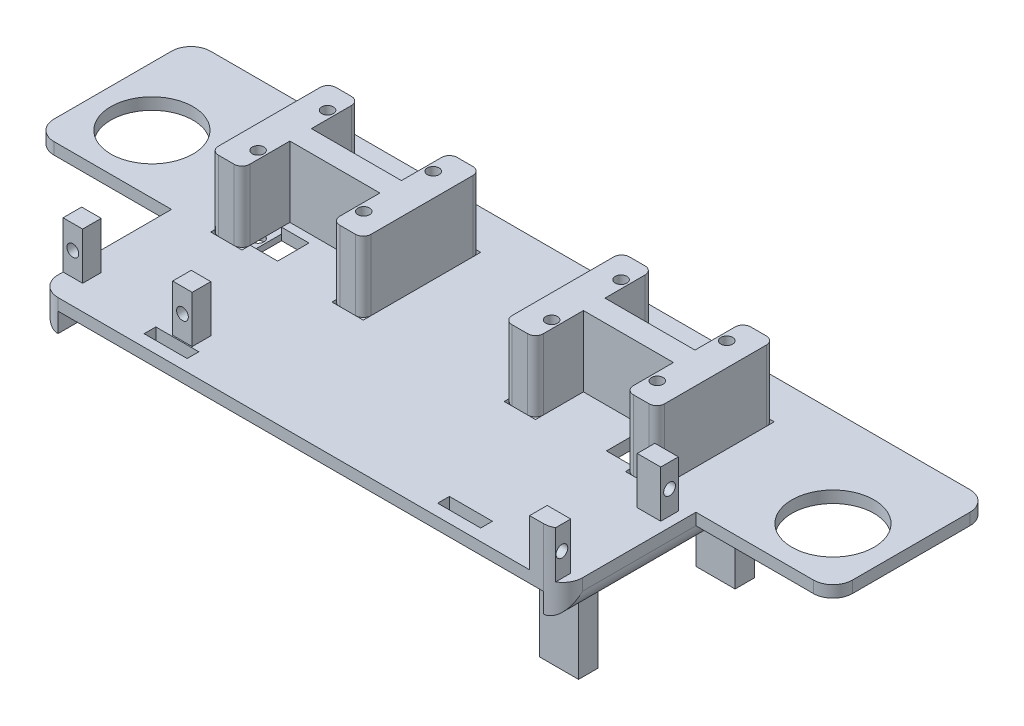
from build123d import *

# Parameters (mm, degrees)
C_BRACKET_DEPTH             = 10
SKETCH3_W                   = 35
SKETCH3_H                   = 40
SKETCH3_R                   = 10.5
MAIN_BODY_DEPTH             = 3
SKETCH4_W                   = 5
SKETCH4_H                   = 74
BOSS_EXTRUDE4_DEPTH         = 5
SKETCH6_W                   = 10
SKETCH6_H                   = 45
C_BRACKET_INSERT_DEPTH      = 1.5
MOTOR_HOLDERS_DEPTH         = 18
MOTOR_HOLDERS_2_DEPTH       = 18
MOTOR_HOLDER_INSERT_DEPTH   = 1.5
STRAP_START                 = -21
SKETCH12_R                  = 1.5
SKETCH12_W                  = 7
SKETCH12_H                  = 8
SKETCH12_W_2                = 11
SKETCH12_H_2                = 3
SKETCH12_W_3                = 5
STRAP_AND_SCREW_HOLES_DEPTH = 21
SKETCH13_W                  = 6
SKETCH13_H                  = 4.5
BOSS_EXTRUDE8_DEPTH         = 12
SKETCH14_R                  = 1.5
CUT_EXTRUDE6_DEPTH          = 6
SKETCH15_W                  = 5
SKETCH15_H                  = 4.75
BOSS_EXTRUDE9_DEPTH         = 12
SKETCH16_R                  = 1.5
CUT_EXTRUDE7_DEPTH          = 4.75
FILLET1_R                   = 5
FILLET2_R                   = 2
FILLET3_R                   = 2
SKETCH17_W                  = 40
SKETCH17_H                  = 10
BOSS_EXTRUDE11_DEPTH        = 5


with BuildPart() as part:
    # Sketch1 → C Bracket (new body)
    with BuildSketch(Plane(origin=(0, 0, 0), x_dir=(0, 0, -1), z_dir=(1, 0, 0))):
        Polygon((0, 0), (0, 30), (45, 30), (45, 0), (40, 0), (40, 27), (5, 27), (5, 0), align=None)
    extrude(amount=C_BRACKET_DEPTH)


with BuildPart() as body_2:
    # Sketch3 → Main Body (new body)
    # profile 1 of 3: a face of its own
    with BuildSketch(Plane(origin=(0, 30, 0), x_dir=(1, 0, 0), z_dir=(0, 1, 0))):
        Polygon((-113, 19), (-113, -15), (21, -15), (21, 19), (21, 59), (-113, 59), align=None)
    # profile 2 of 3: a face of its own
    with BuildSketch(Plane(origin=(0, 30, 0), x_dir=(1, 0, 0), z_dir=(0, 1, 0))):
        with Locations((-130.5, 39)):
            Rectangle(SKETCH3_W, SKETCH3_H)
        with Locations(Location((-133, 34, 0), (0, 0, 270))):
            Circle(SKETCH3_R, mode=Mode.SUBTRACT)
    # profile 3 of 3: a face of its own
    with BuildSketch(Plane(origin=(0, 30, 0), x_dir=(1, 0, 0), z_dir=(0, 1, 0))):
        with Locations((38.5, 39)):
            Rectangle(SKETCH3_W, SKETCH3_H)
        with Locations(Location((41, 34, 0), (0, 0, 270))):
            Circle(SKETCH3_R, mode=Mode.SUBTRACT)
    extrude(amount=MAIN_BODY_DEPTH)

    # Sketch4 → Boss-Extrude4 (add)
    with BuildSketch(Plane.XZ.offset(-30)):
        with Locations((-110.5, -22)):
            Rectangle(SKETCH4_W, SKETCH4_H)
        with Locations((18.5, -22)):
            Rectangle(SKETCH4_W, SKETCH4_H)
    extrude(amount=BOSS_EXTRUDE4_DEPTH)

    # Sketch6 → C Bracket Insert (cut)
    with BuildSketch(Plane.XZ.offset(-30)):
        with Locations((5, -22.5)):
            Rectangle(SKETCH6_W, SKETCH6_H)
    extrude(amount=-C_BRACKET_INSERT_DEPTH, mode=Mode.SUBTRACT)

    # Sketch11 → Motor Holder Insert (cut)
    with BuildSketch(Plane(origin=(0, 33, 0), x_dir=(1, 0, 0), z_dir=(0, 1, 0))):
        Polygon((-20, 36.75), (-20, 49), (-28, 49), (-28, 19), (-20, 19), (-20, 31.25), (3, 31.25), (3, 19), (11, 19), (11, 49), (3, 49), (3, 36.75), align=None)
        Polygon((-72, 19), (-72, 31.25), (-95, 31.25), (-95, 19), (-103, 19), (-103, 49), (-95, 49), (-95, 36.75), (-72, 36.75), (-72, 49), (-64, 49), (-64, 19), align=None)
    extrude(amount=-MOTOR_HOLDER_INSERT_DEPTH, mode=Mode.SUBTRACT)


with BuildPart() as body_3:
    # Sketch5 → Motor Holders (new body)
    with BuildSketch(Plane(origin=(0, 33, 0), x_dir=(1, 0, 0), z_dir=(0, 1, 0))):
        Polygon((-20, 31.25), (3, 31.25), (3, 19), (11, 19), (11, 49), (3, 49), (3, 36.75), (-20, 36.75), (-20, 49), (-28, 49), (-28, 19), (-20, 19), align=None)
    extrude(amount=MOTOR_HOLDERS_DEPTH)


with BuildPart() as body_4:
    # Sketch5 → Motor Holders 2 (new body)
    with BuildSketch(Plane(origin=(0, 33, 0), x_dir=(1, 0, 0), z_dir=(0, 1, 0))):
        Polygon((-95, 36.75), (-95, 49), (-103, 49), (-103, 19), (-95, 19), (-95, 31.25), (-72, 31.25), (-72, 19), (-64, 19), (-64, 49), (-72, 49), (-72, 36.75), align=None)
    extrude(amount=MOTOR_HOLDERS_2_DEPTH)


with BuildPart() as strap_and_screw_holes_tool:
    # Sketch12 → Strap and Screw Holes (new body)
    with BuildSketch(Plane(origin=(0, 51, 0), x_dir=(1, 0, 0), z_dir=(0, 1, 0)).offset(STRAP_START)):
        with Locations(Location((5, 42.875, 0), (0, 0, 270))):
            Circle(SKETCH12_R)
        with Locations(Location((5, 25.125, 0), (0, 0, 90))):
            Circle(SKETCH12_R)
        with Locations(Location((-22, 25.125, 0), (0, 0, 270))):
            Circle(SKETCH12_R)
        with Locations(Location((-22, 42.875, 0), (0, 0, 90))):
            Circle(SKETCH12_R)
        with Locations(Location((-70, 42.875, 0), (0, 0, 270))):
            Circle(SKETCH12_R)
        with Locations(Location((-70, 25.125, 0), (0, 0, 90))):
            Circle(SKETCH12_R)
        with Locations(Location((-97, 25.125, 0), (0, 0, 270))):
            Circle(SKETCH12_R)
        with Locations(Location((-97, 42.875, 0), (0, 0, 90))):
            Circle(SKETCH12_R)
        with Locations((-0.5, 42.875)):
            Rectangle(SKETCH12_W, SKETCH12_H)
        with Locations((-8.5, 54.5)):
            Rectangle(SKETCH12_W_2, SKETCH12_H_2)
        with Locations((-0.5, 25.125)):
            Rectangle(SKETCH12_W, SKETCH12_H)
        with Locations((-8.5, -10.5)):
            Rectangle(SKETCH12_W_2, SKETCH12_H_2)
        with Locations((-83.5, -10.5)):
            Rectangle(SKETCH12_W_2, SKETCH12_H_2)
        with Locations((-91.5, 25.125)):
            Rectangle(SKETCH12_W, SKETCH12_H)
        with Locations((-83.5, 54.5)):
            Rectangle(SKETCH12_W_2, SKETCH12_H_2)
        with Locations((-91.5, 42.875)):
            Rectangle(SKETCH12_W, SKETCH12_H)
        with Locations((-105.5, 34)):
            Rectangle(SKETCH12_W_3, SKETCH12_H)
        with Locations((-30.5, 34)):
            Rectangle(SKETCH12_W_3, SKETCH12_H)
    extrude(amount=STRAP_AND_SCREW_HOLES_DEPTH)


with BuildPart() as body_2_1:
    add(body_2.part)

    # Strap and Screw Holes: cut by strap_and_screw_holes_tool
    add(strap_and_screw_holes_tool.part, mode=Mode.SUBTRACT)

    # Sketch13 → Boss-Extrude8 (add)
    with BuildSketch(Plane(origin=(0, 33, 0), x_dir=(1, 0, 0), z_dir=(0, 1, 0))):
        with Locations((15.5, -12.75)):
            Rectangle(SKETCH13_W, SKETCH13_H)
        with Locations((15.5, 14.75)):
            Rectangle(SKETCH13_W, SKETCH13_H)
    extrude(amount=BOSS_EXTRUDE8_DEPTH)

    # Sketch14 → Cut-Extrude6 (cut)
    with BuildSketch(Plane(origin=(18.5, 0, 0), x_dir=(0, 0, -1), z_dir=(1, 0, 0))):
        with Locations((-12.75, 39)):
            Circle(SKETCH14_R)
        with Locations((14.75, 39)):
            Circle(SKETCH14_R)
    extrude(amount=-CUT_EXTRUDE6_DEPTH, mode=Mode.SUBTRACT)

    # Sketch15 → Boss-Extrude9 (add)
    with BuildSketch(Plane(origin=(0, 33, 0), x_dir=(1, 0, 0), z_dir=(0, 1, 0))):
        with Locations((-110.5, -6.325)):
            Rectangle(SKETCH15_W, SKETCH15_H)
        with Locations((-82.5, -6.325)):
            Rectangle(SKETCH15_W, SKETCH15_H)
    extrude(amount=BOSS_EXTRUDE9_DEPTH)

    # Sketch16 → Cut-Extrude7 (cut)
    with BuildSketch(Plane.XY.offset(8.7)):
        with Locations((-110.5, 39)):
            Circle(SKETCH16_R)
        with Locations((-82.5, 39)):
            Circle(SKETCH16_R)
    extrude(amount=-CUT_EXTRUDE7_DEPTH, mode=Mode.SUBTRACT)

    # Fillet1
    fillet1_edges = [body_2_1.edges().sort_by_distance(p)[0] for p in [
        (-113, 25, -22),
        (21, 25, -22),
        (21, 29, 15),
        (-113, 29, 15),
        (56, 31.5, -19),
        (56, 31.5, -59),
        (-148, 31.5, -19),
        (-148, 31.5, -59),
    ]]
    fillet(fillet1_edges, radius=FILLET1_R - 0.0001)  # a hair under: the kernel refuses the full size

    # Sketch17 → Boss-Extrude11 (add)
    with BuildSketch(Plane.XZ.offset(-30)):
        with Locations((-46, -22)):
            Rectangle(SKETCH17_W, SKETCH17_H)
        with Locations((-88, -3.5)):
            Rectangle(SKETCH17_W, SKETCH17_H)
    extrude(amount=BOSS_EXTRUDE11_DEPTH)


with BuildPart() as body_3_1:
    add(body_3.part)

    # Strap and Screw Holes: cut by strap_and_screw_holes_tool
    add(strap_and_screw_holes_tool.part, mode=Mode.SUBTRACT)

    # Fillet3
    fillet3_edges = [body_3_1.edges().sort_by_distance(p)[0] for p in [
        (-20, 42, -19),
        (-28, 42, -19),
        (-28, 42, -49),
        (-20, 42, -49),
        (3, 42, -49),
        (11, 42, -49),
        (11, 42, -19),
        (3, 42, -19),
    ]]
    fillet(fillet3_edges, radius=FILLET3_R)


with BuildPart() as body_4_1:
    add(body_4.part)

    # Strap and Screw Holes: cut by strap_and_screw_holes_tool
    add(strap_and_screw_holes_tool.part, mode=Mode.SUBTRACT)

    # Fillet2
    fillet2_edges = [body_4_1.edges().sort_by_distance(p)[0] for p in [
        (-72, 42, -49),
        (-64, 42, -49),
        (-64, 42, -19),
        (-72, 42, -19),
        (-95, 42, -19),
        (-103, 42, -19),
        (-103, 42, -49),
        (-95, 42, -49),
    ]]
    fillet(fillet2_edges, radius=FILLET2_R)


solid = Compound([part.part, body_2_1.part, body_3_1.part, body_4_1.part])
